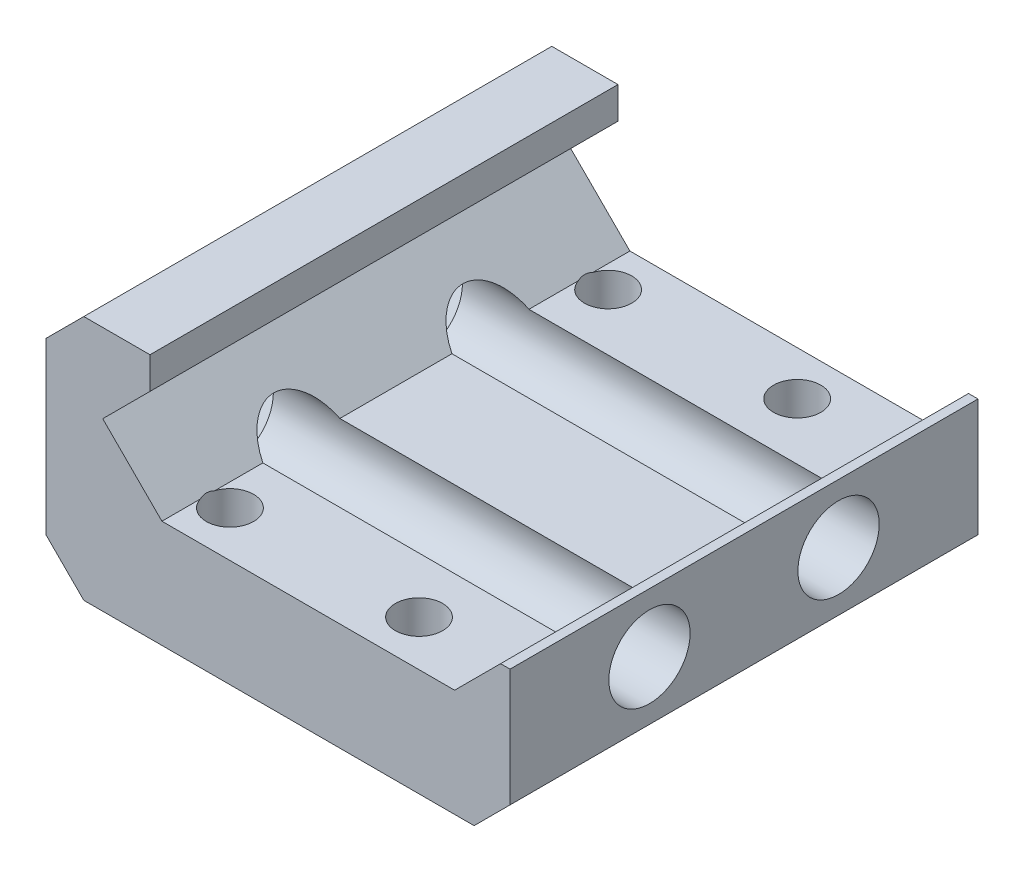
from build123d import *

# Parameters (mm, degrees)
DODANIE_WYCI_GNI_CIE3_DEPTH = 24.75
SZKIC3_R                    = 2.15
WYTNIJ_WYCI_GNI_CIE1_DEPTH  = 36.952280873
CUT_EXTRUDE1_DEPTH          = 34.975380793
CHAMFER1_SIZE               = 2
F_2_5_2_5_DIAMETER_HOLE1_D  = 2.5
CUT_EXTRUDE2_DEPTH          = 2.5


with BuildPart() as part:
    # Szkic1 → Dodanie-wyciągnięcie3 (new body)
    with BuildSketch(Plane.XY):
        Polygon((-3, 4.18), (2.5, 4.18), (2.5, 2.5), (0, 0), (3.13, -3.13), (18.61, -3.13), (21.54, -0.2), (21.54, -6.92), (19.64, -8.82), (-3, -8.82), align=None)
    extrude(amount=DODANIE_WYCI_GNI_CIE3_DEPTH)

    # Szkic3 → Wytnij-wyciągnięcie1 (cut, through all)
    with BuildSketch(Plane(origin=(21.54, 0, 0), x_dir=(0, 0, -1), z_dir=(1, 0, 0))):
        with Locations((-17.375, -3.82)):
            Circle(SZKIC3_R)
        with Locations((-7.375, -3.82)):
            Circle(SZKIC3_R)
    extrude(amount=-WYTNIJ_WYCI_GNI_CIE1_DEPTH, mode=Mode.SUBTRACT)

    # Sketch1 → Cut-Extrude1 (cut, through all)
    with BuildSketch(Plane.XY.offset(24.75)):
        Polygon((21.04, -0.7), (21.54, -0.7), (21.54, -0.2), align=None)
    extrude(amount=-CUT_EXTRUDE1_DEPTH, mode=Mode.SUBTRACT)

    # Chamfer1
    chamfer1_edges = [part.edges().sort_by_distance(p)[0] for p in [
        (-3, 4.18, 12.375),
        (-3, -8.82, 12.375),
    ]]
    chamfer(chamfer1_edges, length=CHAMFER1_SIZE)

    # Ø2.5 (2.5) Diameter Hole1 (through all)
    with Locations(Plane(origin=(0, -8.82, 0), x_dir=(-1, 0, 0), z_dir=(0, -1, 0))):
        with Locations((-4.32, -2.341796682), (-14.32, -2.341796682), (-14.32, -22.341796682), (-4.32, -22.341796682)):
            Hole(F_2_5_2_5_DIAMETER_HOLE1_D / 2)

    # Sketch6 → Cut-Extrude2 (cut)
    with BuildSketch(Plane.ZY.offset(3)):
        Polygon((9.309123402, -7.17), (11.243246804, -3.82), (9.309123402, -0.47), (5.440876598, -0.47), (3.506753196, -3.82), (5.440876598, -7.17), align=None)
        Polygon((15.440876598, -7.17), (19.309123402, -7.17), (21.243246804, -3.82), (19.309123402, -0.47), (15.440876598, -0.47), (13.506753196, -3.82), align=None)
    extrude(amount=-CUT_EXTRUDE2_DEPTH, mode=Mode.SUBTRACT)


solid = part.part
